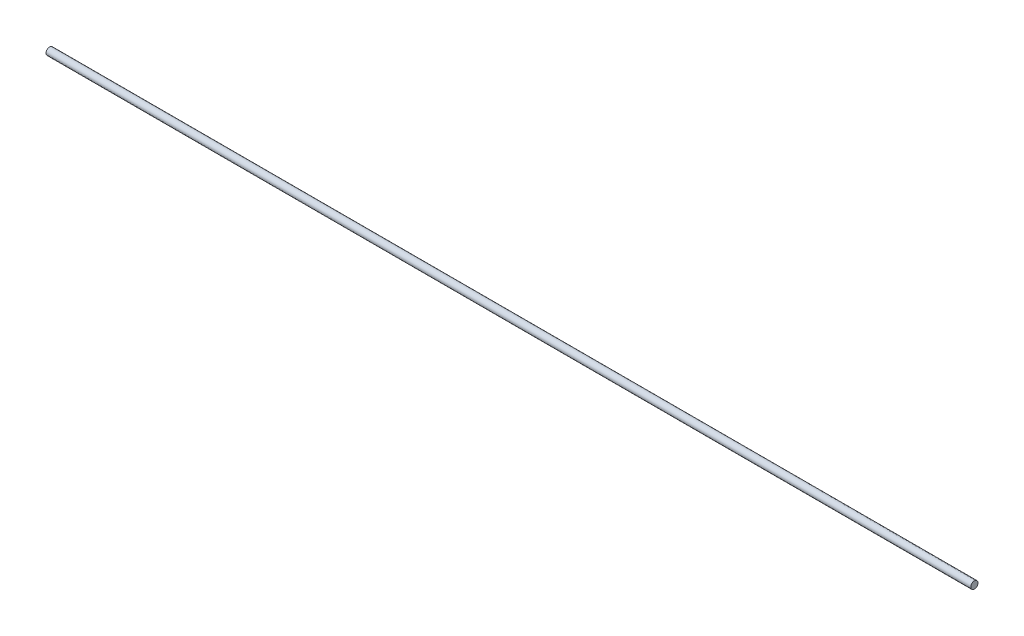
from build123d import *

# Parameters (mm, degrees)
SKETCH1_R           = 3.175
BOSS_EXTRUDE1_DEPTH = 812.8


with BuildPart() as part:
    # Sketch1 → Boss-Extrude1 (new body)
    with BuildSketch(Plane(origin=(0, 0, 0), x_dir=(0, 0, -1), z_dir=(1, 0, 0))):
        with Locations((5.917984348, 4.796241471)):
            Circle(SKETCH1_R)
    extrude(amount=BOSS_EXTRUDE1_DEPTH)


solid = part.part
